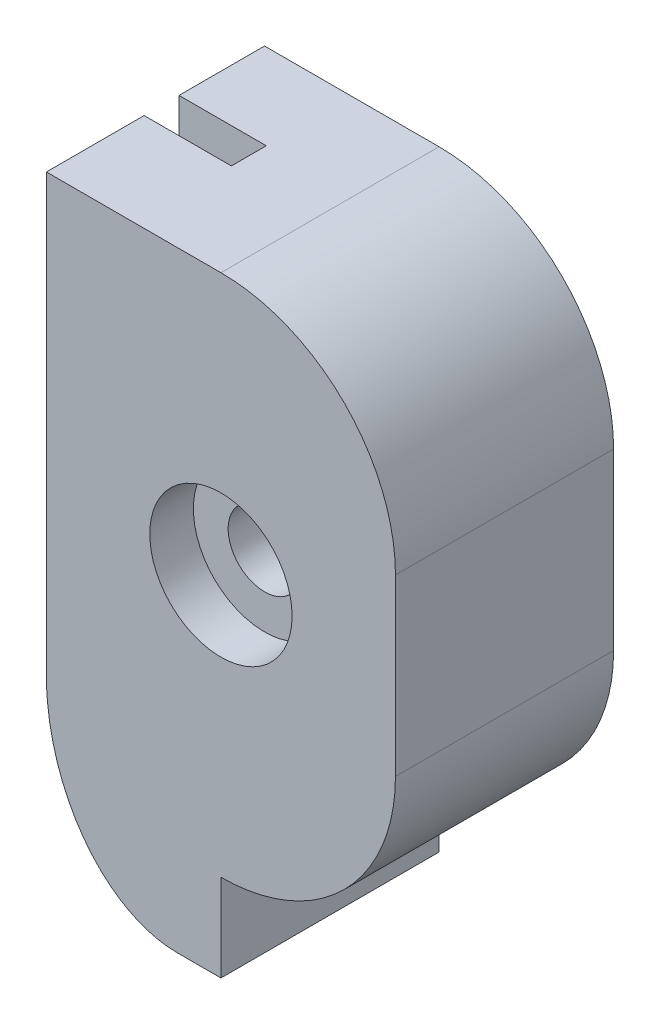
from build123d import *

# Parameters (mm, degrees)
SKETCH1_W           = 40
SKETCH1_H           = 60
BOSS_EXTRUDE1_DEPTH = 12.5
SKETCH4_W           = 4
SKETCH4_H           = 60
CUT_EXTRUDE1_DEPTH  = 10
CUT_EXTRUDE2_DEPTH  = 4
FILLET1_R           = 20
SKETCH6_W           = 20
SKETCH6_H           = 25
BOSS_EXTRUDE2_DEPTH = 10
FILLET2_SIZE        = 15
FILLET2_SIZE_2      = 20


with BuildPart() as part:
    # Sketch1 → Boss-Extrude1 (new, symmetric)
    with BuildSketch(Plane.XY):
        Rectangle(SKETCH1_W, SKETCH1_H)
    extrude(amount=BOSS_EXTRUDE1_DEPTH, both=True)

    # Sketch3 → Cut-Revolve1 (revolve, cut)
    with BuildSketch(Plane(origin=(0, 0, 0), x_dir=(0, 0, -1), z_dir=(1, 0, 0)), mode=Mode.PRIVATE) as cut_revolve1_sk:
        Polygon((-12.5, -8.157480559), (-7.5, -8.157480559), (-7.5, -4.169784019), (7.5, -4.169784019), (7.5, -8.157480559), (12.5, -8.157480559), (12.5, 0), (-12.5, 0), align=None)
    revolve(cut_revolve1_sk.sketch.rotate(Axis((0, 0, 19.169416837), (0, 0, -1)), 270), axis=Axis((0, 0, 19.169416837), (0, 0, -1)), mode=Mode.SUBTRACT)

    # Sketch4 → Cut-Extrude1 (cut)
    with BuildSketch(Plane.ZY.offset(20)):
        with Locations((-0.695939916, 0)):
            Rectangle(SKETCH4_W, SKETCH4_H)
    extrude(amount=-CUT_EXTRUDE1_DEPTH, mode=Mode.SUBTRACT)

    # Sketch5 → Cut-Extrude2 (cut)
    with BuildSketch(Plane.XY.offset(-12.5)):
        Polygon((0, -5.5), (-20, 1.779404685), (-20, 3.184119345), (0, -4.09528534), align=None)
    extrude(amount=CUT_EXTRUDE2_DEPTH, mode=Mode.SUBTRACT)

    # Fillet1
    fillet1_edges = [part.edges().sort_by_distance(p)[0] for p in [
        (20, 30, 0),
        (20, -30, 0),
    ]]
    fillet(fillet1_edges, radius=FILLET1_R)

    # Sketch6 → Boss-Extrude2 (add)
    with BuildSketch(Plane(origin=(0, -30, 0), x_dir=(1, 0, 0), z_dir=(0, 1, 0))):
        with Locations((-10, 0)):
            Rectangle(SKETCH6_W, SKETCH6_H)
    extrude(amount=-BOSS_EXTRUDE2_DEPTH)

    # Fillet2
    # an asymmetric fillet: 20, 15 mm, written as the material it takes off along each edge
    with BuildSketch(Plane(origin=(-20, -40, -62.5), x_dir=(1, 0, 0), z_dir=(0, 0, 1))) as fillet2_piece_1:
        with BuildLine():
            Bezier((FILLET2_SIZE, 0), (0, 0), (0, FILLET2_SIZE_2), weights=[1, 0.707106781, 1])
            Line((0, FILLET2_SIZE_2), (0, 0))
            Line((0, 0), (FILLET2_SIZE, 0))
        make_face()
    extrude(amount=125, mode=Mode.SUBTRACT)


solid = part.part
